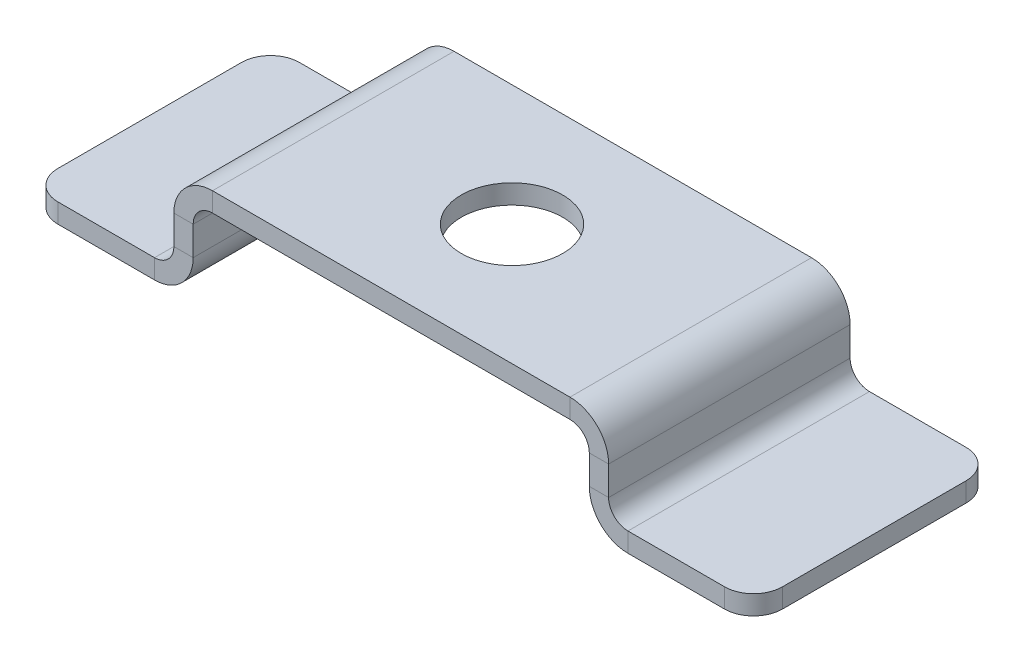
from build123d import *

# Parameters (mm, degrees)
BASE_FLANGE1_DEPTH = 25
SKETCH7_R          = 5.25
CUT_EXTRUDE1_DEPTH = 10
FILLET1_R          = 3


# Sheet-metal steps are written as plain solids
with BuildPart() as part:
    # Sketch1 → Base-Flange1 (new body)
    with BuildSketch(Plane.XY):
        with BuildLine():
            Line((-37.5, 0), (-24.5, 0))
            ThreePointArc((-24.5, 0), (-23.085786438, 0.585786438), (-22.5, 2))
            Line((-22.5, 2), (-22.5, 5))
            ThreePointArc((-22.5, 5), (-21.328427125, 7.828427125), (-18.5, 9))
            Line((-18.5, 9), (18.5, 9))
            ThreePointArc((18.5, 9), (21.328427125, 7.828427125), (22.5, 5))
            Line((22.5, 5), (22.5, 2))
            ThreePointArc((22.5, 2), (23.085786438, 0.585786438), (24.5, 0))
            Line((24.5, 0), (37.5, 0))
            Line((37.5, 0), (37.5, -2))
            Line((37.5, -2), (24.5, -2))
            ThreePointArc((24.5, -2), (21.671572875, -0.828427125), (20.5, 2))
            Line((20.5, 2), (20.5, 5))
            ThreePointArc((20.5, 5), (19.914213562, 6.414213562), (18.5, 7))
            Line((18.5, 7), (-18.5, 7))
            ThreePointArc((-18.5, 7), (-19.914213562, 6.414213562), (-20.5, 5))
            Line((-20.5, 5), (-20.5, 2))
            ThreePointArc((-20.5, 2), (-21.671572875, -0.828427125), (-24.5, -2))
            Line((-24.5, -2), (-37.5, -2))
            Line((-37.5, -2), (-37.5, 0))
        make_face()
    extrude(amount=BASE_FLANGE1_DEPTH)

    # Sketch7 → Cut-Extrude1 (cut)
    with BuildSketch(Plane(origin=(0, 9, 0), x_dir=(1, 0, 0), z_dir=(0, 1, 0))):
        with Locations(Location((0, -12.5, 0), (0, 0, 270))):
            Circle(SKETCH7_R)
    extrude(amount=-CUT_EXTRUDE1_DEPTH, mode=Mode.SUBTRACT)

    # Fillet1
    fillet1_edges = [part.edges().sort_by_distance(p)[0] for p in [
        (-37.5, -1, 0),
        (37.5, -1, 0),
        (-37.5, -1, 25),
        (37.5, -1, 25),
    ]]
    fillet(fillet1_edges, radius=FILLET1_R)


solid = part.part
